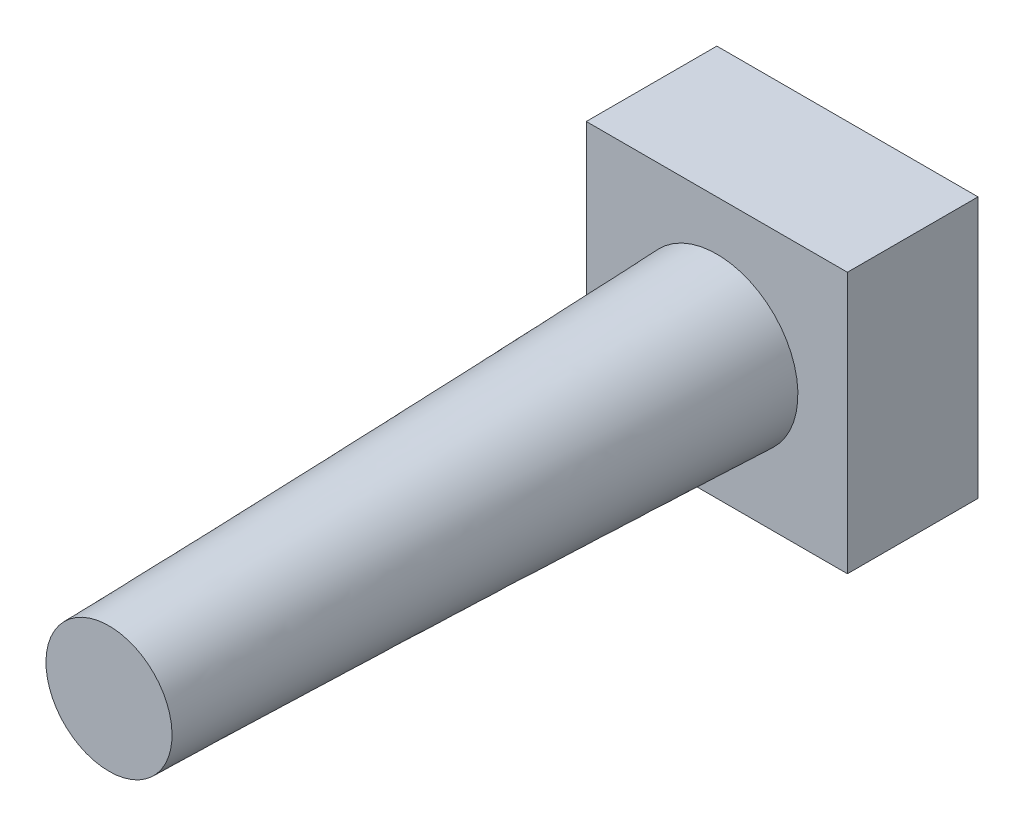
from build123d import *

# Parameters (mm, degrees)
SKETCH1_W           = 5.8
SKETCH1_H           = 5.8
BOSS_EXTRUDE1_DEPTH = 2.9


with BuildPart() as part:
    # Sketch1 → Boss-Extrude1 (new body)
    with BuildSketch(Plane.XY):
        Rectangle(SKETCH1_W, SKETCH1_H)
    extrude(amount=BOSS_EXTRUDE1_DEPTH)

    # Loft1: read off the stored shape, not the designer's step
    # Loft1: loft between two sections, ruled curve by curve
    loft1_from = [
        Edge.make_bspline([(0.877386601, 1.090959556, 16.4), (3.059305712, -0.663813647, 16.4), (1.30453251, -2.845732758, 16.4), (-0.877386601, -1.090959556, 16.4), (-3.059305712, 0.663813647, 16.4), (-1.30453251, 2.845732758, 16.4), (0.877386601, 1.090959556, 16.4)], [0, 0, 0, 0, 0.5, 0.5, 0.5, 1, 1, 1, 1], 3, [1, 0.333333333, 0.333333333, 1, 0.333333333, 0.333333333, 1]),
    ]
    loft1_to = [
        Edge.make_bspline([(1.548183001, 0.918220777, 2.9), (3.384624555, -2.178145225, 2.9), (0.288258553, -4.014586779, 2.9), (-1.548183001, -0.918220777, 2.9), (-3.384624555, 2.178145225, 2.9), (-0.288258553, 4.014586779, 2.9), (1.548183001, 0.918220777, 2.9)], [0, 0, 0, 0, 0.5, 0.5, 0.5, 1, 1, 1, 1], 3, [1, 0.333333333, 0.333333333, 1, 0.333333333, 0.333333333, 1]),
    ]
    loft1 = Solid(Shell([*[Face.make_surface_from_curves(loft1_from[k], loft1_to[k]) for k in range(1)], Face(Wire(loft1_from)), Face(Wire(loft1_to))]))
    add(loft1)


solid = part.part
